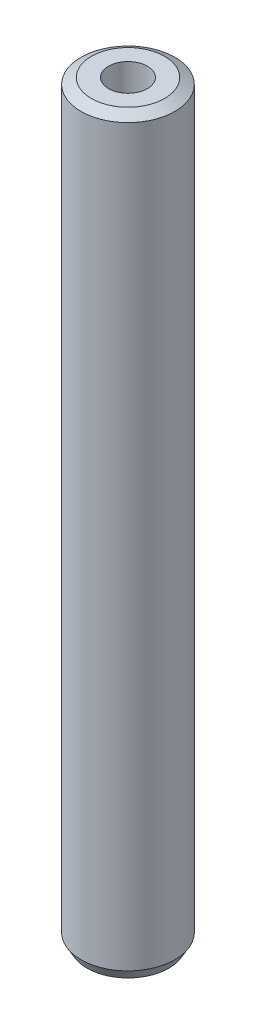
from build123d import *
from OCP.BRepFilletAPI import BRepFilletAPI_MakeChamfer

# Parameters (mm, degrees)
SKETCH1_R           = 37.5
BOSS_EXTRUDE1_DEPTH = 600
SKETCH2_R           = 15.538057261
CUT_EXTRUDE1_DEPTH  = 603.339190158
CHAMFER1_SIZE       = 4.779422394
CHAMFER1_SIZE2      = 8.278202417


with BuildPart() as part:
    # Sketch1 → Boss-Extrude1 (new body)
    with BuildSketch(Plane(origin=(0, 0, 0), x_dir=(1, 0, 0), z_dir=(0, 1, 0))):
        Circle(SKETCH1_R)
    extrude(amount=BOSS_EXTRUDE1_DEPTH)

    # Sketch2 → Cut-Extrude1 (cut, through all)
    with BuildSketch(Plane(origin=(0, 0, 0), x_dir=(1, 0, 0), z_dir=(0, 1, 0))):
        Circle(SKETCH2_R)
    extrude(amount=CUT_EXTRUDE1_DEPTH, mode=Mode.SUBTRACT)

    # Chamfer1: one chamfer whose edges measure the first distance from different faces: ONE call of the kernel's chamfer builder (chamfer() names one face for all edges)
    chamfer1_edges_1 = [part.edges().sort_by_distance(p)[0] for p in [
        (-37.5, 600, 0),
    ]]
    chamfer1_side_1 = [part.faces().sort_by_distance(p)[0] for p in [
        (-37.5, 300, 0),
    ]]
    chamfer1_edges_2 = [part.edges().sort_by_distance(p)[0] for p in [
        (-37.5, 0, 0),
    ]]
    chamfer1_side_2 = [part.faces().sort_by_distance(p)[0] for p in [
        (-36.439339828, 0, 0),
    ]]
    chamfer1 = BRepFilletAPI_MakeChamfer(part.part.solid().wrapped)
    for e in chamfer1_edges_1:
        chamfer1.Add(CHAMFER1_SIZE, CHAMFER1_SIZE2, e.wrapped, chamfer1_side_1[0].wrapped)  # the first distance lies on this face
    for e in chamfer1_edges_2:
        chamfer1.Add(CHAMFER1_SIZE, CHAMFER1_SIZE2, e.wrapped, chamfer1_side_2[0].wrapped)  # the first distance lies on this face
    add(Compound.cast(chamfer1.Shape()), mode=Mode.REPLACE)


solid = part.part
